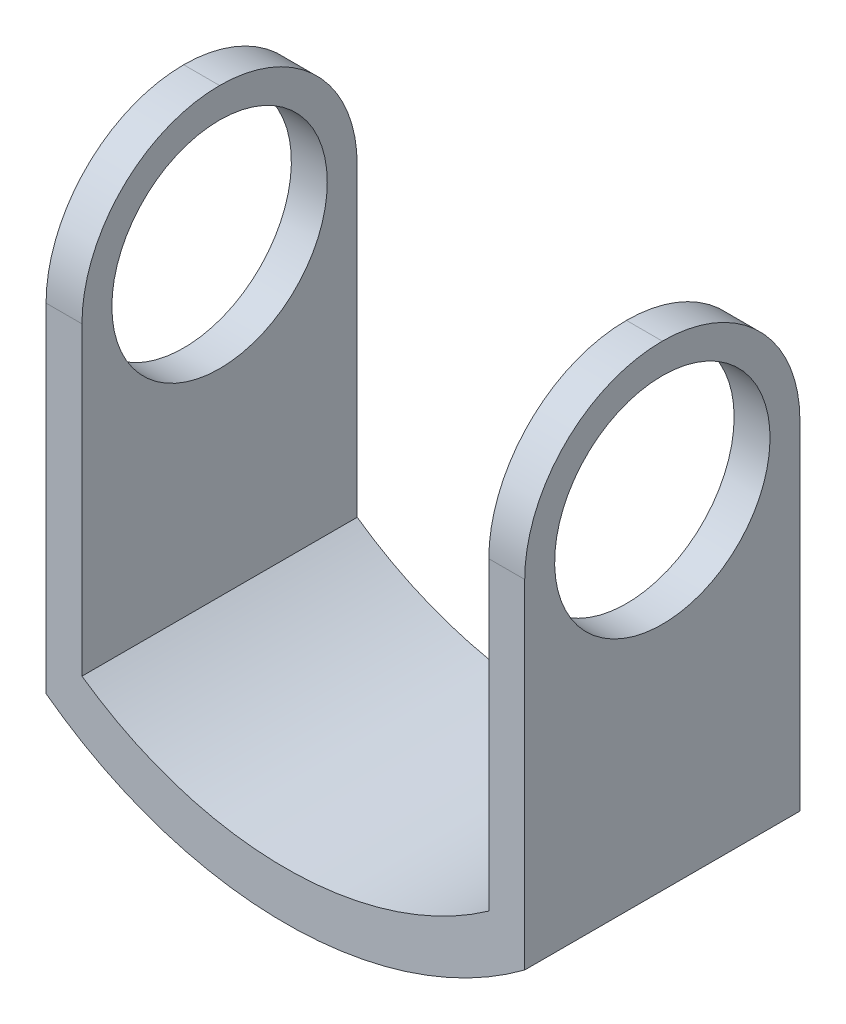
from build123d import *

# Parameters (mm, degrees)
BOSS_EXTRU_1_DEPTH      = 11.5
ENL_V_MAT_EXTRU_1_REACH = 34.715
ESQUISSE3_R             = 4.5
CONG_1_R                = 5.75


with BuildPart() as part:
    # Esquisse1 → Boss.-Extru.1 (new body)
    with BuildSketch(Plane.XY):
        with BuildLine():
            Line((-10, 0), (-8.5, 0))
            Line((-8.5, 0), (-8.5, -18.5))
            ThreePointArc((-8.5, -18.5), (0, -21.195436549), (8.5, -18.5))
            Line((8.5, -18.5), (8.5, 0))
            Line((8.5, 0), (10, 0))
            Line((10, 0), (10, -19.882791199))
            ThreePointArc((10, -19.882791199), (0, -23.195436549), (-10, -19.882791199))
            Line((-10, -19.882791199), (-10, 0))
        make_face()
    extrude(amount=BOSS_EXTRU_1_DEPTH)

    # Enlèv. mat.-Extru.1: up to this face of the body (flat: up to its plane)
    enl_v_mat_extru_1_end = Plane(part.part.faces().sort_by_distance((-10, -9.9413956, 5.75))[0])
    # Esquisse3 → Enlèv. mat.-Extru.1 (cut, up to the picked face)
    with BuildSketch(Plane(origin=(10, 0, 0), x_dir=(0, 0, -1), z_dir=(1, 0, 0)), mode=Mode.PRIVATE) as enl_v_mat_extru_1_sk1:
        with Locations(Location((-5.75, -5.75, 0), (0, 0, 90))):
            Circle(ESQUISSE3_R)
    enl_v_mat_extru_1_tool1 = split(extrude(enl_v_mat_extru_1_sk1.sketch, amount=-ENL_V_MAT_EXTRU_1_REACH, mode=Mode.PRIVATE), bisect_by=enl_v_mat_extru_1_end, keep=Keep.BOTH, mode=Mode.PRIVATE)
    add(enl_v_mat_extru_1_tool1.solids().sort_by(Axis((10, -5.75, 5.75), (-1, 0, 0)))[0], mode=Mode.SUBTRACT)

    # Congé1
    cong_1_edges = [part.edges().sort_by_distance(p)[0] for p in [
        (-9.25, 0, 0),
        (-9.25, 0, 11.5),
        (9.25, 0, 0),
        (9.25, 0, 11.5),
    ]]
    fillet(cong_1_edges, radius=CONG_1_R - 0.0001)  # a hair under: the kernel refuses the full size


solid = part.part
